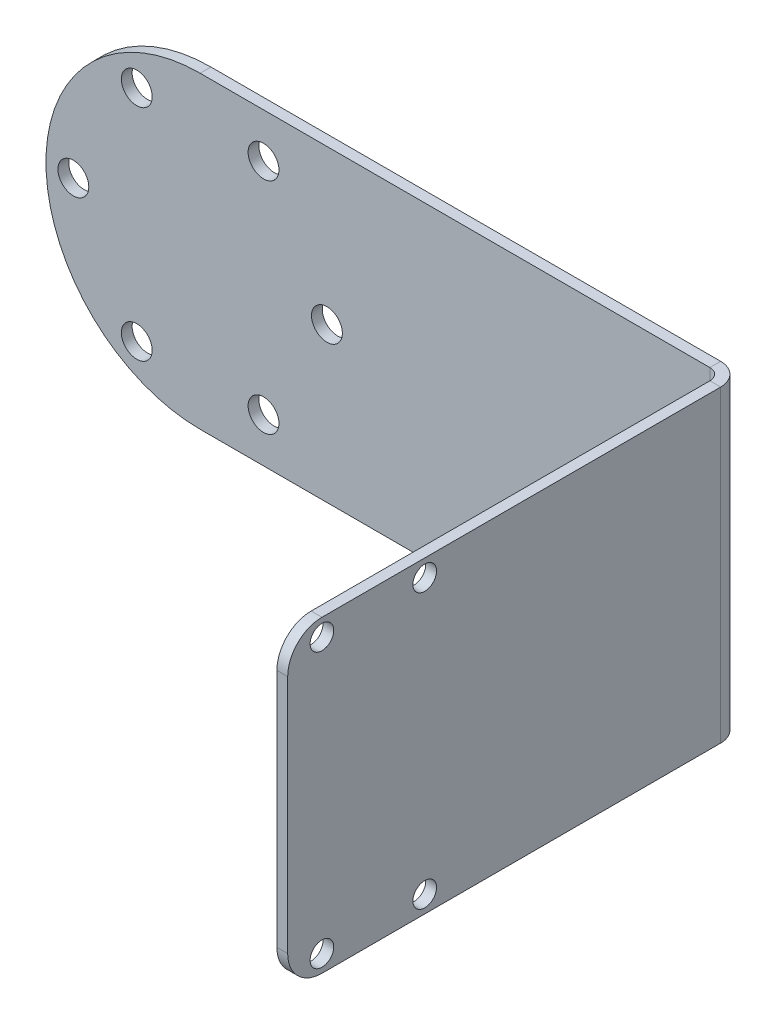
from build123d import *

# Parameters (mm, degrees)
SKETCH1_R                  = 2.25
SKETCH1_R_2                = 1.725
BASE_FLANGE1_DEPTH         = 1.5748
SKETCHED_START             = 77.296428764
SKETCHED_BEND1_OUTLINE_W   = 45
SKETCHED_BEND1_OUTLINE_H   = 1.5748
SKETCHED_BEND1_DEPTH       = 63.903571236
SKETCHED_START_2           = 74.388620508
SKETCHED_BEND1_2_OUTLINE_W = 45
SKETCHED_BEND1_2_OUTLINE_H = 64.865020508
SKETCHED_BEND1_2_OUTLINE_R = 1.725
SKETCHED_BEND1_2_DEPTH     = 3.2512
SKETCHED_START_3           = -22.5
SKETCHED_BEND1_3_DEPTH     = 45
FILLET1_R                  = 5


with BuildPart() as part:
    # Base-Flange1: sheet metal written as solids
    # Sketch1 → Base-Flange1 (new body)
    with BuildSketch(Plane.XY):
        with BuildLine():
            Line((0, -22.5), (141.2, -22.5))
            Line((141.2, -22.5), (141.2, 22.5))
            Line((141.2, 22.5), (0, 22.5))
            ThreePointArc((0, 22.5), (-22.5, 0), (0, -22.5))
        make_face()
        with Locations((9.25, 16.02146997)):
            Circle(SKETCH1_R, mode=Mode.SUBTRACT)
        with Locations((18.5, 0)):
            Circle(SKETCH1_R, mode=Mode.SUBTRACT)
        with Locations((9.25, -16.02146997)):
            Circle(SKETCH1_R, mode=Mode.SUBTRACT)
        with Locations((-9.25, -16.02146997)):
            Circle(SKETCH1_R, mode=Mode.SUBTRACT)
        with Locations((-18.5, 0)):
            Circle(SKETCH1_R, mode=Mode.SUBTRACT)
        with Locations((-9.25, 16.02146997)):
            Circle(SKETCH1_R, mode=Mode.SUBTRACT)
        with Locations((121.2, 20)):
            Circle(SKETCH1_R_2, mode=Mode.SUBTRACT)
        with Locations((136.2, 20)):
            Circle(SKETCH1_R_2, mode=Mode.SUBTRACT)
        with Locations((136.2, -20)):
            Circle(SKETCH1_R_2, mode=Mode.SUBTRACT)
        with Locations((121.2, -20)):
            Circle(SKETCH1_R_2, mode=Mode.SUBTRACT)
    extrude(amount=-BASE_FLANGE1_DEPTH)

    # Sketched Bend1: read off the stored shape, not the designer's step
    # Sketched Bend1 outline → Sketched Bend1 (cut)
    with BuildSketch(Plane.YZ.offset(SKETCHED_START)):
        with Locations((0, -0.7874)):
            Rectangle(SKETCHED_BEND1_OUTLINE_W, SKETCHED_BEND1_OUTLINE_H)
    extrude(amount=SKETCHED_BEND1_DEPTH, mode=Mode.SUBTRACT)

    # Sketched Bend1 2 outline → Sketched Bend1 2 (add)
    with BuildSketch(Plane.YZ.offset(SKETCHED_START_2)):
        with Locations((0, 32.432510254)):
            Rectangle(SKETCHED_BEND1_2_OUTLINE_W, SKETCHED_BEND1_2_OUTLINE_H)
        with Locations((-20, 44.865020508)):
            Circle(SKETCHED_BEND1_2_OUTLINE_R, mode=Mode.SUBTRACT)
        with Locations((-20, 59.865020508)):
            Circle(SKETCHED_BEND1_2_OUTLINE_R, mode=Mode.SUBTRACT)
        with Locations((20, 44.865020508)):
            Circle(SKETCHED_BEND1_2_OUTLINE_R, mode=Mode.SUBTRACT)
        with Locations((20, 59.865020508)):
            Circle(SKETCHED_BEND1_2_OUTLINE_R, mode=Mode.SUBTRACT)
    extrude(amount=SKETCHED_BEND1_2_DEPTH)

    # Sketched Bend1 3 outline → Sketched Bend1 3 (cut)
    with BuildSketch(Plane(origin=(0, 0, 0), x_dir=(1, 0, 0), z_dir=(0, 1, 0)).offset(SKETCHED_START_3)):
        with BuildLine():
            ThreePointArc((74.388620508, 1.5748), (76.687566075, 0.622545567), (77.639820508, -1.6764))
            Line((77.639820508, -1.6764), (77.639820508, 0))
            Line((77.639820508, 0), (77.296428764, 0))
            Line((77.296428764, 0), (77.296428764, 1.5748))
            Line((77.296428764, 1.5748), (74.388620508, 1.5748))
        make_face()
        with BuildLine():
            Line((76.065020508, -64.865020508), (76.065020508, -1.6764))
            ThreePointArc((76.065020508, -1.6764), (75.574014316, -0.491006192), (74.388620508, 0))
            Line((74.388620508, 0), (74.388620508, -64.865020508))
            Line((74.388620508, -64.865020508), (76.065020508, -64.865020508))
        make_face()
    extrude(amount=SKETCHED_BEND1_3_DEPTH, mode=Mode.SUBTRACT)

    # Fillet1
    fillet1_edges = [part.edges().sort_by_distance(p)[0] for p in [
        (76.852420508, 22.5, 64.865020508),
        (76.852420508, -22.5, 64.865020508),
    ]]
    fillet(fillet1_edges, radius=FILLET1_R)


solid = part.part
